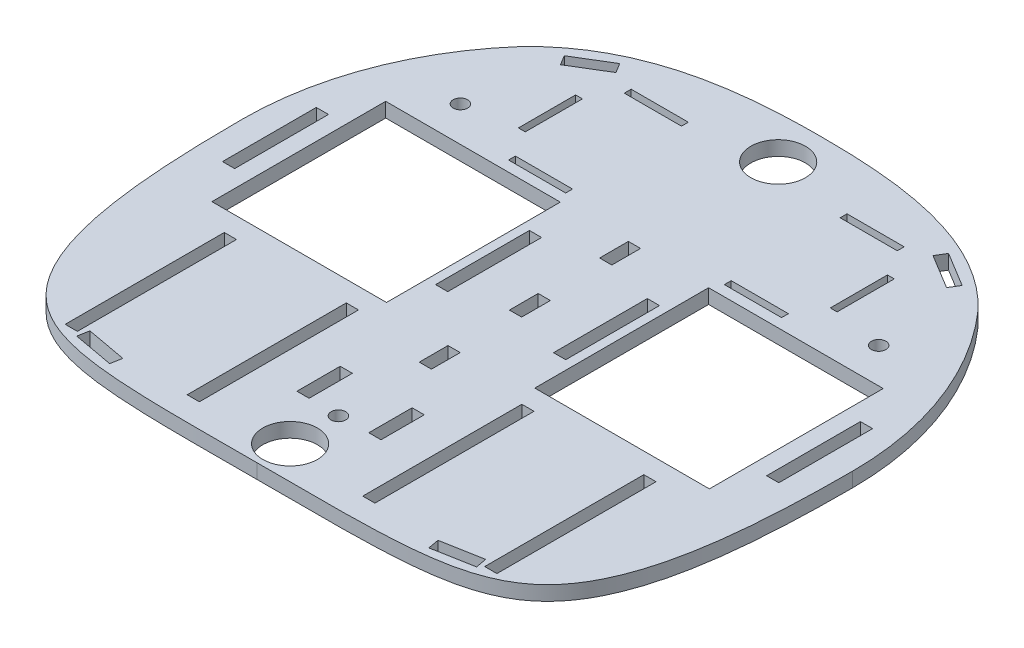
from build123d import *

# Parameters (mm, degrees)
BASE_DEPTH            = 6.35
SKETCH6_W             = 76.3515
SKETCH6_H             = 76
SKETCH6_W_2           = 5.334
SKETCH6_H_2           = 41.021
WHEELSHAFTCUT_DEPTH   = 189.692256213
SKETCH8_W             = 5.334
SKETCH8_H             = 69.573
SKETCH8_H_2           = 18.923
MOTORCUT_DEPTH        = 189.692256213
SKETCH10_W            = 25
SKETCH10_H            = 3
SKETCH10_W_2          = 3
SKETCH10_H_2          = 25
VELCROCUT_DEPTH       = 189.692256213
SKETCH11_R            = 3.175
SCREWCUT_DEPTH        = 189.692256213
SKETCH13_W            = 5.334
SKETCH13_H            = 12.573
SUPPORTSTRUTCUT_DEPTH = 189.692256213
EMPTYSPACETRIM_DEPTH  = 189.692256213
TAPESENSORCUT_DEPTH   = 185.275595127
SKETCH17_R            = 11.938
CASTERCUT_DEPTH       = 185.275595127


with BuildPart() as part:
    # Sketch1 → Base (new body)
    with BuildSketch(Plane(origin=(0, 0, 0), x_dir=(1, 0, 0), z_dir=(0, 1, 0))):
        with BuildLine():
            ThreePointArc((133.35, 0), (0, 133.35), (-133.35, 0))
            add(Edge.make_bspline(
                [(-133.35, 0), (-133.35, -51.197979728), (-123.803376308, -129.805052089), (-58.427993604, -127), (0, -127)],
                knots=[0, 0, 0, 0, 0.502616309, 1, 1, 1, 1], degree=3))
            add(Edge.make_bspline(
                [(133.35, 0), (133.35, -51.197979728), (123.803376308, -129.805052089), (58.427993604, -127), (0, -127)],
                knots=[0, 0, 0, 0, 0.502616309, 1, 1, 1, 1], degree=3))
        make_face()
    extrude(amount=BASE_DEPTH)

    # Sketch6 → WheelShaftCut (cut, through all)
    with BuildSketch(Plane(origin=(0, 6.35, 0), x_dir=(1, 0, 0), z_dir=(0, 1, 0))):
        with Locations((-70.592348141, 0)):
            Rectangle(SKETCH6_W, SKETCH6_H)
        with Locations((-118.959848141, 0)):
            Rectangle(SKETCH6_W_2, SKETCH6_H_2)
        with Locations((-25.780848141, 0)):
            Rectangle(SKETCH6_W_2, SKETCH6_H_2)
        with Locations((25.780848141, 0)):
            Rectangle(SKETCH6_W_2, SKETCH6_H_2)
        with Locations((118.959848141, 0)):
            Rectangle(SKETCH6_W_2, SKETCH6_H_2)
        with Locations((70.592348141, 0)):
            Rectangle(SKETCH6_W, SKETCH6_H)
    extrude(amount=-WHEELSHAFTCUT_DEPTH, mode=Mode.SUBTRACT)

    # Sketch8 → MotorCut (cut, through all)
    with BuildSketch(Plane(origin=(0, 6.35, 0), x_dir=(1, 0, 0), z_dir=(0, 1, 0))):
        with Locations((-38.378348141, -81.74)):
            Rectangle(SKETCH8_W, SKETCH8_H)
        with Locations((-91.718348141, -81.74)):
            Rectangle(SKETCH8_W, SKETCH8_H)
        with Locations((15.718348141, -81.74)):
            Rectangle(SKETCH8_W, SKETCH8_H_2)
        with Locations((91.718348141, -81.74)):
            Rectangle(SKETCH8_W, SKETCH8_H)
        with Locations((38.378348141, -81.74)):
            Rectangle(SKETCH8_W, SKETCH8_H)
        with Locations((-15.718348141, -81.74)):
            Rectangle(SKETCH8_W, SKETCH8_H_2)
    extrude(amount=-MOTORCUT_DEPTH, mode=Mode.SUBTRACT)

    # Sketch10 → VelcroCut (cut, through all)
    with BuildSketch(Plane(origin=(0, 6.35, 0), x_dir=(1, 0, 0), z_dir=(0, 1, 0))):
        with Locations((-47.19, 44.12)):
            Rectangle(SKETCH10_W, SKETCH10_H)
        with Locations((-47.19, 94.745)):
            Rectangle(SKETCH10_W, SKETCH10_H)
        with Locations((-68.175, 69.4325)):
            Rectangle(SKETCH10_W_2, SKETCH10_H_2)
        with Locations((68.175, 69.4325)):
            Rectangle(SKETCH10_W_2, SKETCH10_H_2)
        with Locations((47.19, 94.745)):
            Rectangle(SKETCH10_W, SKETCH10_H)
        with Locations((47.19, 44.12)):
            Rectangle(SKETCH10_W, SKETCH10_H)
    extrude(amount=-VELCROCUT_DEPTH, mode=Mode.SUBTRACT)

    # Sketch11 → ScrewCut (cut, through all)
    with BuildSketch(Plane(origin=(0, 6.35, 0), x_dir=(1, 0, 0), z_dir=(0, 1, 0))):
        with Locations((0, -91.44)):
            Circle(SKETCH11_R)
        with Locations((-91.44, 53.34)):
            Circle(SKETCH11_R)
        with Locations((91.44, 53.34)):
            Circle(SKETCH11_R)
    extrude(amount=-SCREWCUT_DEPTH, mode=Mode.SUBTRACT)

    # Sketch13 → SupportStrutCut (cut, through all)
    with BuildSketch(Plane(origin=(0, 6.35, 0), x_dir=(1, 0, 0), z_dir=(0, 1, 0))):
        with Locations((0, 31.7135)):
            Rectangle(SKETCH13_W, SKETCH13_H)
        with Locations((0, -7.72)):
            Rectangle(SKETCH13_W, SKETCH13_H)
        with Locations((0, -47.1535)):
            Rectangle(SKETCH13_W, SKETCH13_H)
    extrude(amount=-SUPPORTSTRUTCUT_DEPTH, mode=Mode.SUBTRACT)

    # Sketch16 → EmptySpaceTrim (cut, through all)
    with BuildSketch(Plane(origin=(0, 6.35, 0), x_dir=(1, 0, 0), z_dir=(0, 1, 0))):
        with BuildLine():
            Line((-100.033122546, 133.35), (-100.033122546, 88.179345052))
            add(Edge.make_bspline(
                [(-100.033122546, 88.179345052), (-73.919529929, 115.91021885), (-34.972901221, 119.822808394), (0, 119.822808394)],
                knots=[0, 0, 0, 0, 1, 1, 1, 1], degree=3))
            add(Edge.make_bspline(
                [(100.033122546, 88.179345052), (73.919529929, 115.91021885), (34.972901221, 119.822808394), (0, 119.822808394)],
                knots=[0, 0, 0, 0, 1, 1, 1, 1], degree=3))
            Line((100.033122546, 88.179345052), (100.033122546, 133.35))
            Line((100.033122546, 133.35), (-100.033122546, 133.35))
        make_face()
    extrude(amount=-EMPTYSPACETRIM_DEPTH, mode=Mode.SUBTRACT)

    # Sketch15 → TapeSensorCut (cut, through all)
    with BuildSketch(Plane(origin=(0, 6.35, 0), x_dir=(1, 0, 0), z_dir=(0, 1, 0))):
        Polygon((-87.418704088, -118.459321106), (-69.765704088, -121.679864084), (-68.876770565, -116.807287128), (-86.529770565, -113.58674415), align=None)
        Polygon((-84.406611309, 90.060423031), (-69.317948313, 99.223427887), (-71.888863344, 103.456937649), (-86.97752634, 94.293932793), align=None)
        Polygon((86.97752634, 94.293932793), (71.888863344, 103.456937649), (69.317948313, 99.223427887), (84.406611309, 90.060423031), align=None)
        Polygon((86.529770565, -113.58674415), (68.876770565, -116.807287128), (69.765704088, -121.679864084), (87.418704088, -118.459321106), align=None)
    extrude(amount=-TAPESENSORCUT_DEPTH, mode=Mode.SUBTRACT)

    # Sketch17 → CasterCut (cut, through all)
    with BuildSketch(Plane(origin=(0, 6.35, 0), x_dir=(1, 0, 0), z_dir=(0, 1, 0))):
        with Locations((0, 100.834589665)):
            Circle(SKETCH17_R)
        with Locations((0, -112.562458365)):
            Circle(SKETCH17_R)
    extrude(amount=-CASTERCUT_DEPTH, mode=Mode.SUBTRACT)


solid = part.part
